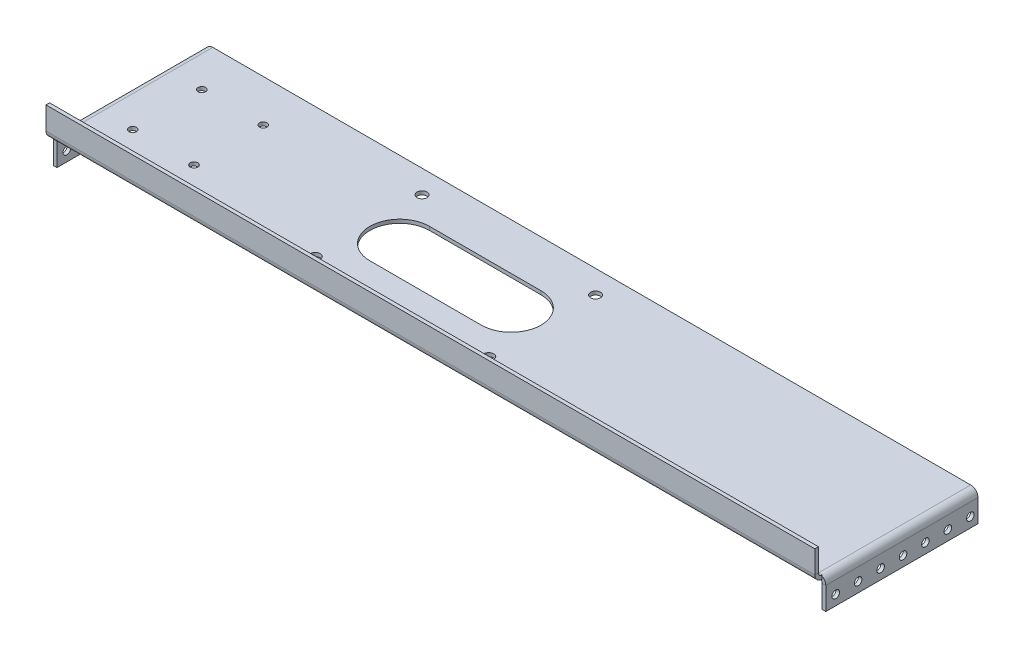
from build123d import *

# Parameters (mm, degrees)
SKETCH1_W                    = 489.688000048
SKETCH1_H                    = 177.8
BASE_FLANGE1_DEPTH           = 2.286
EDGE_FLANGE1_STRIP_W         = 13.864
EDGE_FLANGE1_STRIP_H         = 2.286
EDGE_FLANGE1_STRIP_CUT_DEPTH = 489.688000048
EDGE_FLANGE1_DEPTH           = 489.688000048
EDGE_FLANGE2_STRIP_W         = 13.864
EDGE_FLANGE2_STRIP_H         = 2.286
EDGE_FLANGE2_STRIP_CUT_DEPTH = 173.154
EDGE_FLANGE2_DEPTH           = 173.154
EDGE_FLANGE3_STRIP_W         = 13.864
EDGE_FLANGE3_STRIP_H         = 2.286
EDGE_FLANGE3_STRIP_CUT_DEPTH = 173.154
EDGE_FLANGE3_DEPTH           = 173.154
SKETCH15_R                   = 3.15
CUT_EXTRUDE1_DEPTH           = 6.35
SKETCH33_W                   = 491.974000048
SKETCH33_H                   = 152.4
CUT_EXTRUDE5_DEPTH           = 264.323659043
SKETCH40_R                   = 2.413
CUT_EXTRUDE10_DEPTH          = 501.304436542
SKETCH42_R                   = 2.4
CUT_EXTRUDE11_DEPTH          = 264.323659043


# Sheet-metal steps are written as plain solids
with BuildPart() as part:
    # Sketch1 → Base-Flange1 (new body)
    with BuildSketch(Plane(origin=(0, 0, 0), x_dir=(1, 0, 0), z_dir=(0, 1, 0))):
        Rectangle(SKETCH1_W, SKETCH1_H)
    extrude(amount=-BASE_FLANGE1_DEPTH)

    # Edge-Flange1 strip (across the edge) → Edge-Flange1 strip cut (cut)
    with BuildSketch(Plane(origin=(-244.844000024, 0, 88.9), x_dir=(0, 0, -1), z_dir=(1, 0, 0))):
        with Locations((-2.286, -1.143)):
            Rectangle(EDGE_FLANGE1_STRIP_W, EDGE_FLANGE1_STRIP_H)
    extrude(amount=EDGE_FLANGE1_STRIP_CUT_DEPTH, mode=Mode.SUBTRACT)

    # Edge-Flange1 section (across the edge) → Edge-Flange1 (add)
    with BuildSketch(Plane(origin=(-244.844000024, 0, 88.9), x_dir=(0, 0, -1), z_dir=(1, 0, 0))):
        with BuildLine():
            Line((0, 2.36), (0, 16.764))
            Line((0, 16.764), (2.286, 16.764))
            Line((2.286, 16.764), (2.286, 2.36))
            ThreePointArc((2.286, 2.36), (2.977227996, 0.691227996), (4.646, 0))
            Line((4.646, 0), (4.646, -2.286))
            ThreePointArc((4.646, -2.286), (1.360781895, -0.925218105), (0, 2.36))
        make_face()
    extrude(amount=EDGE_FLANGE1_DEPTH)

    # Edge-Flange2 strip (across the edge) → Edge-Flange2 strip cut (cut)
    with BuildSketch(Plane(origin=(-244.844000024, -2.286, 84.254), x_dir=(1, 0, 0), z_dir=(0, 0, -1))):
        with Locations((-2.286, -1.143)):
            Rectangle(EDGE_FLANGE2_STRIP_W, EDGE_FLANGE2_STRIP_H)
    extrude(amount=EDGE_FLANGE2_STRIP_CUT_DEPTH, mode=Mode.SUBTRACT)

    # Edge-Flange2 section (across the edge) → Edge-Flange2 (add)
    with BuildSketch(Plane(origin=(-244.844000024, -2.286, 84.254), x_dir=(1, 0, 0), z_dir=(0, 0, -1))):
        with BuildLine():
            Line((0, 2.36), (0, 16.764))
            Line((0, 16.764), (2.286, 16.764))
            Line((2.286, 16.764), (2.286, 2.36))
            ThreePointArc((2.286, 2.36), (2.977227996, 0.691227996), (4.646, 0))
            Line((4.646, 0), (4.646, -2.286))
            ThreePointArc((4.646, -2.286), (1.360781895, -0.925218105), (0, 2.36))
        make_face()
    extrude(amount=EDGE_FLANGE2_DEPTH)

    # Edge-Flange3 strip (across the edge) → Edge-Flange3 strip cut (cut)
    with BuildSketch(Plane(origin=(244.844000024, -2.286, -88.9), x_dir=(-1, 0, 0), z_dir=(0, 0, 1))):
        with Locations((-4.572, -1.143)):
            Rectangle(EDGE_FLANGE3_STRIP_W, EDGE_FLANGE3_STRIP_H)
    extrude(amount=EDGE_FLANGE3_STRIP_CUT_DEPTH, mode=Mode.SUBTRACT)

    # Edge-Flange3 section (across the edge) → Edge-Flange3 (add)
    with BuildSketch(Plane(origin=(244.844000024, -2.286, -88.9), x_dir=(-1, 0, 0), z_dir=(0, 0, 1))):
        with BuildLine():
            Line((-2.286, 2.36), (-2.286, 16.764))
            Line((-2.286, 16.764), (0, 16.764))
            Line((0, 16.764), (0, 2.36))
            ThreePointArc((0, 2.36), (0.691227996, 0.691227996), (2.36, 0))
            Line((2.36, 0), (2.36, -2.286))
            ThreePointArc((2.36, -2.286), (-0.925218105, -0.925218105), (-2.286, 2.36))
        make_face()
    extrude(amount=EDGE_FLANGE3_DEPTH)

    # Sketch15 → Cut-Extrude1 (cut)
    with BuildSketch(Plane(origin=(0, 0, 0), x_dir=(1, 0, 0), z_dir=(0, 1, 0))):
        with Locations(Location((-92.248000024, -1.994, 0), (0, 0, 270))):
            Circle(SKETCH15_R)
        with Locations(Location((-92.248000024, -69.994, 0), (0, 0, 270))):
            Circle(SKETCH15_R)
        with Locations(Location((18.251999976, -69.994, 0), (0, 0, 270))):
            Circle(SKETCH15_R)
        with Locations(Location((18.251999976, -1.994, 0), (0, 0, 270))):
            Circle(SKETCH15_R)
        with BuildLine():
            Line((-1.498000024, -54.994), (-72.498000024, -54.994))
            ThreePointArc((-72.498000024, -54.994), (-91.498000024, -35.994), (-72.498000024, -16.994))
            Line((-72.498000024, -16.994), (-1.498000024, -16.994))
            ThreePointArc((-1.498000024, -16.994), (17.501999976, -35.994), (-1.498000024, -54.994))
        make_face()
    extrude(amount=-CUT_EXTRUDE1_DEPTH, mode=Mode.SUBTRACT)

    # Sketch33 → Cut-Extrude5 (cut, through all)
    with BuildSketch(Plane(origin=(0, 0, 0), x_dir=(1, 0, 0), z_dir=(0, 1, 0))):
        with Locations((1.143, 88.9)):
            Rectangle(SKETCH33_W, SKETCH33_H)
    extrude(amount=-CUT_EXTRUDE5_DEPTH, mode=Mode.SUBTRACT)

    # Sketch40 → Cut-Extrude10 (cut, through all)
    with BuildSketch(Plane.ZY.offset(244.844000024)):
        with Locations(Location((77.904, -12.7, 0), (0, 0, 270))):
            Circle(SKETCH40_R)
        with Locations(Location((63.6165, -12.7, 0), (0, 0, 270))):
            Circle(SKETCH40_R)
        with Locations(Location((49.329, -12.7, 0), (0, 0, 270))):
            Circle(SKETCH40_R)
        with Locations(Location((35.0415, -12.7, 0), (0, 0, 270))):
            Circle(SKETCH40_R)
        with Locations(Location((20.754, -12.7, 0), (0, 0, 270))):
            Circle(SKETCH40_R)
        with Locations(Location((6.4665, -12.7, 0), (0, 0, 270))):
            Circle(SKETCH40_R)
        with Locations(Location((-7.821, -12.7, 0), (0, 0, 270))):
            Circle(SKETCH40_R)
    extrude(amount=-CUT_EXTRUDE10_DEPTH, mode=Mode.SUBTRACT)

    # Sketch42 → Cut-Extrude11 (cut, through all)
    with BuildSketch(Plane(origin=(0, 0, 0), x_dir=(1, 0, 0), z_dir=(0, 1, 0))):
        with Locations(Location((-220.419354597, -14.058539081, 0), (0, 0, 270))):
            Circle(SKETCH42_R)
        with Locations(Location((-181.369354597, -14.058539081, 0), (0, 0, 270))):
            Circle(SKETCH42_R)
        with Locations(Location((-181.369354597, -58.108539081, 0), (0, 0, 270))):
            Circle(SKETCH42_R)
        with Locations(Location((-220.419354597, -58.108539081, 0), (0, 0, 270))):
            Circle(SKETCH42_R)
    extrude(amount=-CUT_EXTRUDE11_DEPTH, mode=Mode.SUBTRACT)


solid = part.part
